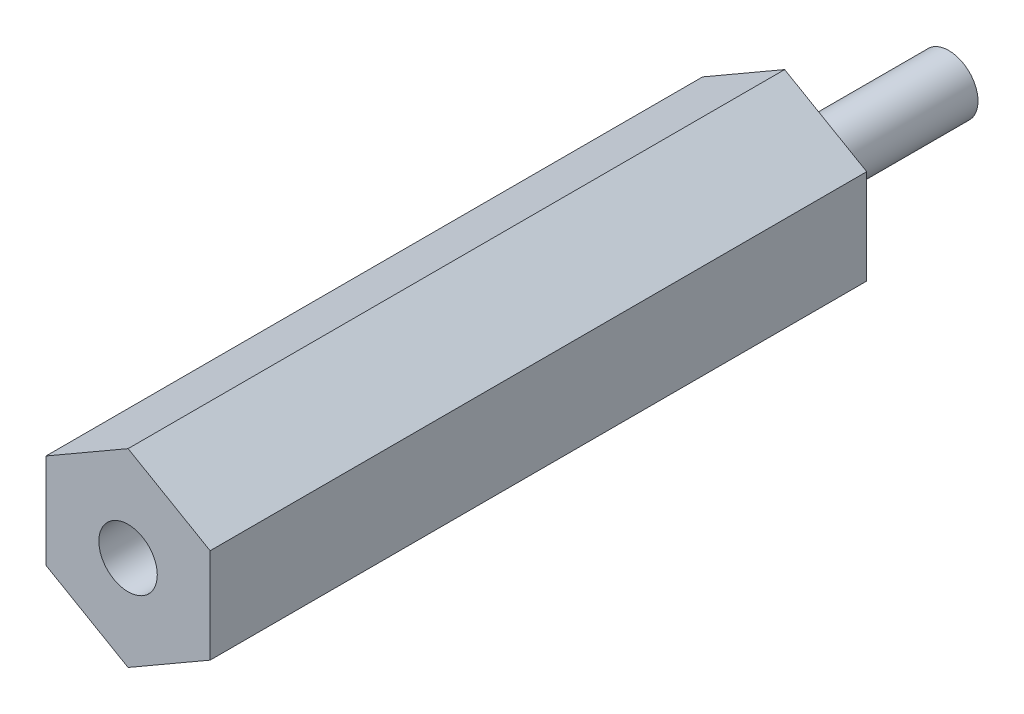
from build123d import *

# Parameters (mm, degrees)
BOSS_EXTRUDE1_DEPTH           = 25.4
TAP_DRILL_FOR_4_40_TAP1_D     = 2.2606
TAP_DRILL_FOR_4_40_TAP1_DEPTH = 12.7
TAP_DRILL_FOR_4_40_TAP1_TIP   = 0.679152758
BOSS_EXTRUDE2_START           = 6.35
SKETCH5_R                     = 1.1303
BOSS_EXTRUDE2_DEPTH           = 6.35


with BuildPart() as part:
    # Sketch1 → Boss-Extrude1 (new body)
    with BuildSketch(Plane.XY):
        Polygon((0, 3.666174209), (-3.175, 1.833087105), (-3.175, -1.833087105), (0, -3.666174209), (3.175, -1.833087105), (3.175, 1.833087105), align=None)
    extrude(amount=BOSS_EXTRUDE1_DEPTH)

    # Tap Drill for #4-40 Tap1
    with Locations(Plane.XY.offset(25.4)):
        with Locations((0, 0)):
            Hole(TAP_DRILL_FOR_4_40_TAP1_D / 2, depth=TAP_DRILL_FOR_4_40_TAP1_DEPTH)
            with Locations((0, 0, -(TAP_DRILL_FOR_4_40_TAP1_DEPTH + TAP_DRILL_FOR_4_40_TAP1_TIP / 2))):  # 118° drill point
                Cone(0, TAP_DRILL_FOR_4_40_TAP1_D / 2, TAP_DRILL_FOR_4_40_TAP1_TIP, mode=Mode.SUBTRACT)

    # Sketch5 → Boss-Extrude2 (add)
    with BuildSketch(Plane(origin=(0, 0, 0), x_dir=(-1, 0, 0), z_dir=(0, 0, -1)).offset(BOSS_EXTRUDE2_START)):
        Circle(SKETCH5_R)
    extrude(amount=-BOSS_EXTRUDE2_DEPTH)


solid = part.part
